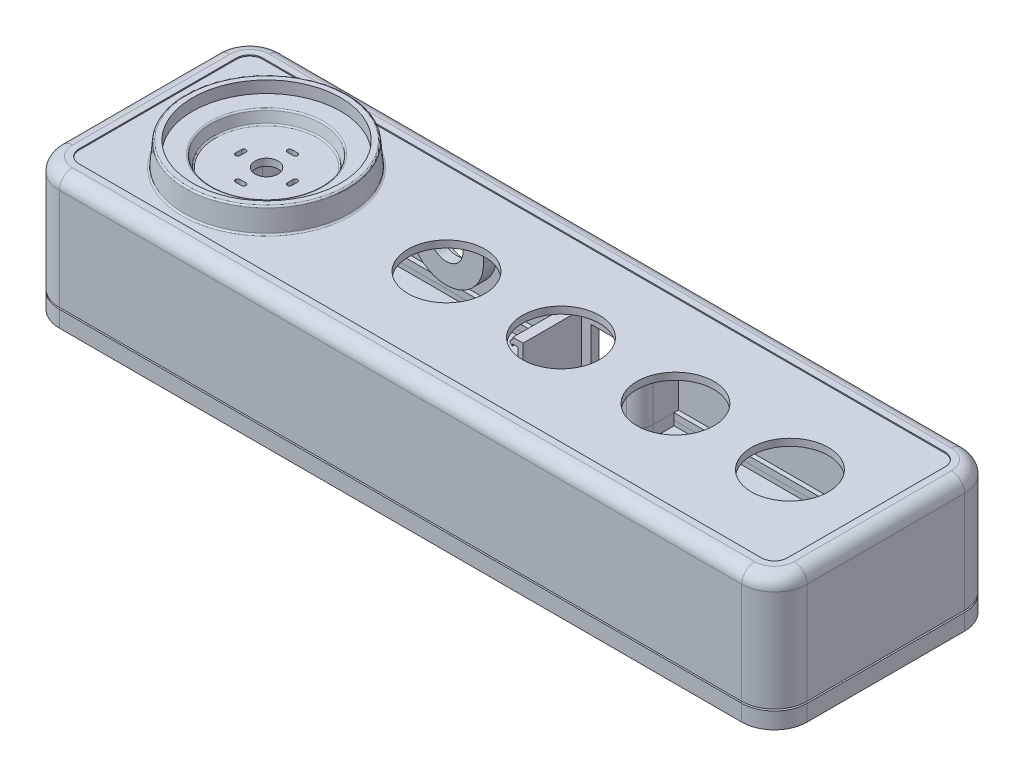
from build123d import *

# Parameters (mm, degrees)
BOSS_EXTRUDE1_DEPTH                            = 35
FILLET1_R                                      = 4
CUT_EXTRUDE6_DEPTH                             = 0.35
SHELL1_T                                       = -2.15
CUT_EXTRUDE1_DEPTH                             = 196.515492994
CUT_EXTRUDE1_DEPTH_BACK                        = 196.515492994
SKETCH1_R                                      = 11.775
SKETCH1_R_2                                    = 3.5
CUT_EXTRUDE4_DEPTH                             = 196.515492994
FILLET3_R                                      = 0.5
CIRPATTERN1_COUNT                              = 4
SKETCH11_R                                     = 2
SKETCH11_R_2                                   = 1.425
BOSS_EXTRUDE3_DEPTH                            = 2
SKETCH11_3_R                                   = 1.425
BOSS_EXTRUDE4_DEPTH                            = 4
BOSS_EXTRUDE5_DEPTH                            = 1.5
CUT_EXTRUDE8_DEPTH                             = 1.5
BOSS_EXTRUDE6_DEPTH                            = 2
BOSS_EXTRUDE7_DEPTH                            = 5
SHELL2_T                                       = -3.5
BOSS_EXTRUDE8_START                            = -15
SKETCH18_R                                     = 2.8
BOSS_EXTRUDE8_DEPTH                            = 15
SKETCH18_3_R                                   = 2.8
CUT_EXTRUDE9_DEPTH                             = 9.5
MIRROR2_START                                  = -15
MIRROR2_COPY_1_SKETCH_R                        = 2.8
MIRROR2_COPY_1_DEPTH                           = 15
MIRROR2_COPY_2_SKETCH_R                        = 2.8
MIRROR2_COPY_2_DEPTH                           = 9.5
CUT_EXTRUDE12_DEPTH                            = 2.28
CUT_EXTRUDE12_DEPTH_BACK                       = 2.28
SKETCH25_W                                     = 14.97
SKETCH25_H                                     = 4.6
CUT_EXTRUDE13_DEPTH                            = 2.82
SKETCH26_W                                     = 8.87
SKETCH26_H                                     = 5.15
BOSS_EXTRUDE13_DEPTH                           = 1.9
SKETCH27_W                                     = 8.87
SKETCH27_H                                     = 1.65
BOSS_EXTRUDE14_DEPTH                           = 0.68
SKETCH29_R                                     = 3.5
SKETCH29_R_2                                   = 5.14
CUT_EXTRUDE14_DEPTH                            = 2.15
SKETCH30_R                                     = 3.5
SKETCH30_R_2                                   = 5.14
BOSS_EXTRUDE15_DEPTH                           = 4
SKETCH31_R                                     = 1.65
CUT_EXTRUDE15_DEPTH                            = 3
SKETCH32_R                                     = 8
SKETCH32_R_2                                   = 6.075
CUT_EXTRUDE16_DEPTH                            = 3
BOSS_EXTRUDE16_DEPTH                           = 31
SKETCH34_W                                     = 9.07
SKETCH34_H                                     = 2.51
BOSS_EXTRUDE17_DEPTH                           = 18.46
BOSS_EXTRUDE18_START                           = 2
BOSS_EXTRUDE18_DEPTH                           = 2
SKETCH36_W                                     = 1.7
SKETCH36_H                                     = 11.2
CUT_EXTRUDE17_DEPTH                            = 0.45
SKETCH37_W                                     = 5.1
SKETCH37_H                                     = 6.27
CUT_EXTRUDE18_DEPTH                            = 0.2
CUT_EXTRUDE19_START                            = -2.15
SKETCH38_R                                     = 2.64
CUT_EXTRUDE19_DEPTH                            = 2.15
SKETCH39_W                                     = 21.06
SKETCH39_H                                     = 15
BOSS_EXTRUDE19_DEPTH                           = 1.5
SKETCH40_R                                     = 1.13
BOSS_EXTRUDE20_DEPTH                           = 2
SKETCH41_W                                     = 21.06
SKETCH41_H                                     = 1.8
SKETCH41_W_2                                   = 20.33
BOSS_EXTRUDE21_DEPTH                           = 1.6
BOSS_EXTRUDE22_DEPTH                           = 1.6
BOSS_EXTRUDE23_DEPTH                           = 15
SKETCH46_R                                     = 2.8
CUT_EXTRUDE21_DEPTH                            = 9.5
BOSS_EXTRUDE25_START                           = 3.5
BOSS_EXTRUDE25_DEPTH                           = 3.5
CSK_FOR_M4_FLAT_HEAD_MACHINE_SCREW1_AT_2_COUNT = 2
CSK_FOR_M4_FLAT_HEAD_MACHINE_SCREW1_AT_2_PITCH = 49.95965928
CSK_FOR_M4_FLAT_HEAD_MACHINE_SCREW1_AT_3_COUNT = 2
CSK_FOR_M4_FLAT_HEAD_MACHINE_SCREW1_AT_3_PITCH = 91.23
CSK_FOR_M4_FLAT_HEAD_MACHINE_SCREW1_AT_4_COUNT = 2
CSK_FOR_M4_FLAT_HEAD_MACHINE_SCREW1_AT_4_PITCH = 116.475847532
CSK_FOR_M4_FLAT_HEAD_MACHINE_SCREW1_AT_5_COUNT = 2
CSK_FOR_M4_FLAT_HEAD_MACHINE_SCREW1_AT_5_PITCH = 216.279338947
CSK_FOR_M4_FLAT_HEAD_MACHINE_SCREW1_AT_6_COUNT = 2
CSK_FOR_M4_FLAT_HEAD_MACHINE_SCREW1_AT_6_PITCH = 210.43


with BuildPart() as part:
    # Sketch2 → Boss-Extrude1 (new body)
    with BuildSketch(Plane(origin=(0, 0, 0), x_dir=(1, 0, 0), z_dir=(0, 1, 0))):
        with BuildLine():
            Line((-29.267817454, 34.05982964), (179.317817454, 34.05982964))
            ThreePointArc((179.317817454, 34.05982964), (186.388885266, 31.130897452), (189.317817454, 24.05982964))
            Line((189.317817454, 24.05982964), (189.317817454, -24.05982964))
            ThreePointArc((189.317817454, -24.05982964), (186.388885266, -31.130897452), (179.317817454, -34.05982964))
            Line((179.317817454, -34.05982964), (-29.267817454, -34.05982964))
            ThreePointArc((-29.267817454, -34.05982964), (-36.338885266, -31.130897452), (-39.267817454, -24.05982964))
            Line((-39.267817454, -24.05982964), (-39.267817454, 24.05982964))
            ThreePointArc((-39.267817454, 24.05982964), (-36.338885266, 31.130897452), (-29.267817454, 34.05982964))
        make_face()
    extrude(amount=-BOSS_EXTRUDE1_DEPTH)

    # Fillet1
    fillet1_edges = [part.edges().sort_by_distance(p)[0] for p in [
        (-39.267817454, 0, 0),
        (-36.338885266, 0, -31.130897452),
        (75.025, 0, -34.05982964),
        (186.388885266, 0, -31.130897452),
        (189.317817454, 0, 0),
        (186.388885266, 0, 31.130897452),
        (75.025, 0, 34.05982964),
        (-36.338885266, 0, 31.130897452),
    ]]
    fillet(fillet1_edges, radius=FILLET1_R)

    # Sketch9 → Cut-Extrude6 (cut)
    with BuildSketch(Plane(origin=(0, 0, 0), x_dir=(1, 0, 0), z_dir=(0, 1, 0))):
        with BuildLine():
            Line((-33.267817454, 24.05982964), (-33.267817454, -24.05982964))
            ThreePointArc((-33.267817454, -24.05982964), (-32.096244578, -26.888256765), (-29.267817454, -28.05982964))
            Line((-29.267817454, -28.05982964), (179.317817454, -28.05982964))
            ThreePointArc((179.317817454, -28.05982964), (182.146244578, -26.888256765), (183.317817454, -24.05982964))
            Line((183.317817454, -24.05982964), (183.317817454, 24.05982964))
            ThreePointArc((183.317817454, 24.05982964), (182.146244578, 26.888256765), (179.317817454, 28.05982964))
            Line((179.317817454, 28.05982964), (-29.267817454, 28.05982964))
            ThreePointArc((-29.267817454, 28.05982964), (-32.096244578, 26.888256765), (-33.267817454, 24.05982964))
        make_face()
    extrude(amount=-CUT_EXTRUDE6_DEPTH, mode=Mode.SUBTRACT)

    # Shell1
    shell1_openings = [part.faces().sort_by_distance(p)[0] for p in [
        (75.025, -35, 0),
    ]]
    offset(amount=SHELL1_T, openings=shell1_openings, kind=Kind.INTERSECTION)

    # Sketch1 → Cut-Extrude1 (cut, two sides: drawn at the far end of the back side and taken through both)
    with BuildSketch(Plane(origin=(0, 0, 0), x_dir=(1, 0, 0), z_dir=(0, 1, 0)).offset(-CUT_EXTRUDE1_DEPTH_BACK)):
        with Locations(Location((55, 0, 0), (0, 0, 270))):
            Circle(SKETCH1_R)
        with Locations(Location((90, 0, 0), (0, 0, 270))):
            Circle(SKETCH1_R)
        with Locations(Location((160, 0, 0), (0, 0, 270))):
            Circle(SKETCH1_R)
        with Locations(Location((125, 0, 0), (0, 0, 270))):
            Circle(SKETCH1_R)
        with Locations(Location((0, 0, 0), (0, 0, 270))):
            Circle(SKETCH1_R_2)
    extrude(amount=CUT_EXTRUDE1_DEPTH + CUT_EXTRUDE1_DEPTH_BACK, mode=Mode.SUBTRACT)

    # Sketch6 → Cut-Extrude4 (cut, symmetric)
    with BuildSketch(Plane(origin=(0, 0, 0), x_dir=(1, 0, 0), z_dir=(0, 1, 0))):
        with BuildLine():
            Line((8.612490822, 0.9), (8.612490822, -0.9))
            ThreePointArc((8.612490822, -0.9), (7.912490822, -1.6), (7.212490822, -0.9))
            Line((7.212490822, -0.9), (7.212490822, 0.9))
            ThreePointArc((7.212490822, 0.9), (7.912490822, 1.6), (8.612490822, 0.9))
        make_face()
    cut_extrude4 = extrude(amount=CUT_EXTRUDE4_DEPTH, both=True, mode=Mode.SUBTRACT)

    # Sketch7 → Revolve1 (revolve)
    with BuildSketch(Plane.XY, mode=Mode.PRIVATE) as revolve1_sk:
        Polygon((-25.278168604, -0.35), (-24.65, 6.83), (-22.65, 6.83), (-22.65, 3.23), (-16.959258109, 3.23), (-16, -0.35), align=None)
    revolve(revolve1_sk.sketch.rotate(Axis((0, 0, 0), (0, 1, 0)), 270), axis=Axis((0, 0, 0), (0, 1, 0)))

    # Fillet3
    fillet3_edges = [part.edges().sort_by_distance(p)[0] for p in [
        (0, -0.35, 25.278168604),
        (0, -0.35, 16),
        (0, 3.23, 16.959258109),
        (0, 6.83, 24.65),
    ]]
    fillet(fillet3_edges, radius=FILLET3_R)

    # CirPattern1: Cut-Extrude4 ×4 about axis
    cirpattern1_axis = Axis((0, 0, 0), (0, 1, 0))
    for i in range(1, CIRPATTERN1_COUNT):
        add(cut_extrude4.rotate(cirpattern1_axis, i * 360 / CIRPATTERN1_COUNT), mode=Mode.SUBTRACT)

    # Sketch11 → Boss-Extrude3 (add)
    # profile 1 of 8: a face of its own
    with BuildSketch(Plane(origin=(0, -2.5, 0), x_dir=(-1, 0, 0), z_dir=(0, -1, 0))):
        with Locations(Location((-33.582182546, 1, 0), (0, 0, 270))):
            Circle(SKETCH11_R)
    # profile 2 of 8: a face of its own
    with BuildSketch(Plane(origin=(0, -2.5, 0), x_dir=(-1, 0, 0), z_dir=(0, -1, 0))):
        with Locations(Location((-20.582182546, 1, 0), (0, 0, 270))):
            Circle(SKETCH11_R)
    # profile 3 of 8: a face of its own
    with BuildSketch(Plane(origin=(0, -2.5, 0), x_dir=(-1, 0, 0), z_dir=(0, -1, 0))):
        with Locations(Location((-28.082182546, -8.5, 0), (0, 0, 270))):
            Circle(SKETCH11_R)
        with Locations((-28.082182546, -8.5)):
            Circle(SKETCH11_R_2, mode=Mode.SUBTRACT)
    # profile 4 of 8: a face of its own
    with BuildSketch(Plane(origin=(0, -2.5, 0), x_dir=(-1, 0, 0), z_dir=(0, -1, 0))):
        with Locations((-28.082182546, -8.5)):
            Circle(SKETCH11_R_2)
    # profile 5 of 8: a face of its own
    with BuildSketch(Plane(origin=(0, -2.5, 0), x_dir=(-1, 0, 0), z_dir=(0, -1, 0))):
        with Locations(Location((-20.582182546, -19, 0), (0, 0, 270))):
            Circle(SKETCH11_R)
        with Locations((-20.582182546, -19)):
            Circle(SKETCH11_R_2, mode=Mode.SUBTRACT)
    # profile 6 of 8: a face of its own
    with BuildSketch(Plane(origin=(0, -2.5, 0), x_dir=(-1, 0, 0), z_dir=(0, -1, 0))):
        with Locations((-20.582182546, -19)):
            Circle(SKETCH11_R_2)
    # profile 7 of 8: a face of its own
    with BuildSketch(Plane(origin=(0, -2.5, 0), x_dir=(-1, 0, 0), z_dir=(0, -1, 0))):
        with Locations(Location((-33.582182546, -19, 0), (0, 0, 270))):
            Circle(SKETCH11_R)
        with Locations((-33.582182546, -19)):
            Circle(SKETCH11_R_2, mode=Mode.SUBTRACT)
    # profile 8 of 8: a face of its own
    with BuildSketch(Plane(origin=(0, -2.5, 0), x_dir=(-1, 0, 0), z_dir=(0, -1, 0))):
        with Locations((-33.582182546, -19)):
            Circle(SKETCH11_R_2)
    extrude(amount=BOSS_EXTRUDE3_DEPTH)

    # Sketch11<3> → Boss-Extrude4 (add)
    with BuildSketch(Plane(origin=(0, -2.5, 0), x_dir=(-1, 0, 0), z_dir=(0, -1, 0))):
        with Locations(Location((-28.082182546, -8.5, 0), (0, 0, 90))):
            Circle(SKETCH11_3_R)
        with Locations(Location((-20.582182546, -19, 0), (0, 0, 90))):
            Circle(SKETCH11_3_R)
        with Locations(Location((-33.582182546, -19, 0), (0, 0, 90))):
            Circle(SKETCH11_3_R)
    extrude(amount=BOSS_EXTRUDE4_DEPTH)

    # Sketch13 → Boss-Extrude5 (add, symmetric)
    with BuildSketch(Plane(origin=(25, 0, 0), x_dir=(0, 0, -1), z_dir=(1, 0, 0))):
        Polygon((-25.25, -2.5), (-25.25, -6.2), (-24, -6.2), (-25.3, -7.5), (-26.8, -7.5), (-27.75, -2.5), align=None)
        Polygon((8.25, -2.5), (8.25, -6.2), (7, -6.2), (8.3, -7.5), (9.8, -7.5), (10.75, -2.5), align=None)
    extrude(amount=BOSS_EXTRUDE5_DEPTH, both=True)

    # Sketch15 → Cut-Extrude8 (cut)
    with BuildSketch(Plane.XZ.offset(35)):
        with BuildLine():
            Line((-29.267817454, -32.75982964), (179.317817454, -32.75982964))
            ThreePointArc((179.317817454, -32.75982964), (185.46964645, -30.211658637), (188.017817454, -24.05982964))
            Line((188.017817454, -24.05982964), (188.017817454, 24.05982964))
            ThreePointArc((188.017817454, 24.05982964), (185.46964645, 30.211658637), (179.317817454, 32.75982964))
            Line((179.317817454, 32.75982964), (-29.267817454, 32.75982964))
            ThreePointArc((-29.267817454, 32.75982964), (-35.41964645, 30.211658637), (-37.967817454, 24.05982964))
            Line((-37.967817454, 24.05982964), (-37.967817454, -24.05982964))
            ThreePointArc((-37.967817454, -24.05982964), (-35.41964645, -30.211658637), (-29.267817454, -32.75982964))
        make_face()
    extrude(amount=-CUT_EXTRUDE8_DEPTH, mode=Mode.SUBTRACT)

    # Sketch18 → Boss-Extrude8 (add)
    # profile 1 of 2: a face of its own
    with BuildSketch(Plane.XZ.offset(33.5).offset(BOSS_EXTRUDE8_START)):
        with BuildLine():
            Line((-37.117817454, 24.05982964), (-37.117817454, 20.05982964))
            Line((-37.117817454, 20.05982964), (-29.267817454, 20.05982964))
            ThreePointArc((-29.267817454, 20.05982964), (-26.439390329, 21.231402515), (-25.267817454, 24.05982964))
            Line((-25.267817454, 24.05982964), (-25.267817454, 31.90982964))
            Line((-25.267817454, 31.90982964), (-29.267817454, 31.90982964))
            ThreePointArc((-29.267817454, 31.90982964), (-34.818605686, 29.610617872), (-37.117817454, 24.05982964))
        make_face()
        with Locations((-30.187817454, 24.97982964)):
            Circle(SKETCH18_R, mode=Mode.SUBTRACT)
    # profile 2 of 2: a face of its own
    with BuildSketch(Plane.XZ.offset(33.5).offset(BOSS_EXTRUDE8_START)):
        with Locations((-30.187817454, 24.97982964)):
            Circle(SKETCH18_R)
    boss_extrude8 = extrude(amount=BOSS_EXTRUDE8_DEPTH)

    # Sketch18<3> → Cut-Extrude9 (cut)
    with BuildSketch(Plane.XZ.offset(33.5)):
        with Locations(Location((-30.187817454, 24.97982964, 0), (0, 0, 270))):
            Circle(SKETCH18_3_R)
    cut_extrude9 = extrude(amount=-CUT_EXTRUDE9_DEPTH, mode=Mode.SUBTRACT)

    # Mirror1: Boss-Extrude8 across plane
    add(boss_extrude8.mirror(Plane.XY))

    # Mirror1 2: Cut-Extrude9 across plane
    add(cut_extrude9.mirror(Plane.XY), mode=Mode.SUBTRACT)

    # Mirror2: Boss-Extrude8, Cut-Extrude9 across plane
    add(boss_extrude8.mirror(Plane.ZY.offset(-75.027182546)))
    add(cut_extrude9.mirror(Plane.ZY.offset(-75.027182546)), mode=Mode.SUBTRACT)

    # Mirror2 copy 1 sketch → Mirror2 copy 1 (add)
    # profile 1 of 2: a face of its own
    with BuildSketch(Plane(origin=(150.054365093, -33.5, 0), x_dir=(-1, 0, 0), z_dir=(0, -1, 0)).offset(MIRROR2_START)):
        with BuildLine():
            Line((-37.117817454, 24.05982964), (-37.117817454, 20.05982964))
            Line((-37.117817454, 20.05982964), (-29.267817454, 20.05982964))
            ThreePointArc((-29.267817454, 20.05982964), (-26.439390329, 21.231402515), (-25.267817454, 24.05982964))
            Line((-25.267817454, 24.05982964), (-25.267817454, 31.90982964))
            Line((-25.267817454, 31.90982964), (-29.267817454, 31.90982964))
            ThreePointArc((-29.267817454, 31.90982964), (-34.818605686, 29.610617872), (-37.117817454, 24.05982964))
        make_face()
        with Locations((-30.187817454, 24.97982964)):
            Circle(MIRROR2_COPY_1_SKETCH_R, mode=Mode.SUBTRACT)
    # profile 2 of 2: a face of its own
    with BuildSketch(Plane(origin=(150.054365093, -33.5, 0), x_dir=(-1, 0, 0), z_dir=(0, -1, 0)).offset(MIRROR2_START)):
        with Locations((-30.187817454, 24.97982964)):
            Circle(MIRROR2_COPY_1_SKETCH_R)
    extrude(amount=MIRROR2_COPY_1_DEPTH)

    # Mirror2 copy 2 sketch → Mirror2 copy 2 (cut)
    with BuildSketch(Plane(origin=(150.054365093, -33.5, 0), x_dir=(-1, 0, 0), z_dir=(0, -1, 0))):
        with Locations(Location((-30.187817454, 24.97982964, 0), (0, 0, 270))):
            Circle(MIRROR2_COPY_2_SKETCH_R)
    extrude(amount=-MIRROR2_COPY_2_DEPTH, mode=Mode.SUBTRACT)

    # Sketch22 → Cut-Extrude12 (cut, two sides: drawn at the far end of the back side and taken through both)
    with BuildSketch(Plane.XY.offset(-32.75982964).offset(-CUT_EXTRUDE12_DEPTH_BACK)):
        with BuildLine():
            Line((67.542182546, -35), (67.542182546, -26.488433197))
            ThreePointArc((67.542182546, -26.488433197), (75.027182546, -19.003433197), (82.512182546, -26.488433197))
            Line((82.512182546, -26.488433197), (82.512182546, -35))
            Line((82.512182546, -35), (67.542182546, -35))
        make_face()
    extrude(amount=CUT_EXTRUDE12_DEPTH + CUT_EXTRUDE12_DEPTH_BACK, mode=Mode.SUBTRACT)

    # Sketch29 → Cut-Extrude14 (cut)
    with BuildSketch(Plane(origin=(0, 0, -34.05982964), x_dir=(-1, 0, 0), z_dir=(0, 0, -1))):
        with Locations((7.117817454, -20.536803536)):
            Circle(SKETCH29_R)
        with Locations((-27.01592381, -20.536803536)):
            Circle(SKETCH29_R_2)
    extrude(amount=-CUT_EXTRUDE14_DEPTH, mode=Mode.SUBTRACT)

    # Sketch30 → Boss-Extrude15 (add)
    with BuildSketch(Plane.XY.offset(-31.90982964)):
        with BuildLine():
            Line((-0.617817454, -20.536803536), (15.62592381, -20.536803536))
            ThreePointArc((15.62592381, -20.536803536), (27.01592381, -31.926803536), (38.40592381, -20.536803536))
            Line((38.40592381, -20.536803536), (38.40592381, -4))
            Line((38.40592381, -4), (-13.617817454, -4))
            Line((-13.617817454, -4), (-13.617817454, -20.536803536))
            ThreePointArc((-13.617817454, -20.536803536), (-7.117817454, -27.036803536), (-0.617817454, -20.536803536))
        make_face()
        with Locations(Location((-7.117817454, -20.536803536, 0), (0, 0, 180))):
            Circle(SKETCH30_R, mode=Mode.SUBTRACT)
        with Locations(Location((27.01592381, -20.536803536, 0), (0, 0, 180))):
            Circle(SKETCH30_R_2, mode=Mode.SUBTRACT)
    extrude(amount=BOSS_EXTRUDE15_DEPTH)

    # Sketch31 → Cut-Extrude15 (cut)
    with BuildSketch(Plane.XY.offset(-27.90982964)):
        with Locations((27.01592381, -11.036803536)):
            Circle(SKETCH31_R)
        with BuildLine():
            Line((-8.042817454, -12.032674317), (-6.192817454, -12.032674317))
            ThreePointArc((-6.192817454, -12.032674317), (-5.507817454, -12.717674317), (-6.192817454, -13.402674317))
            Line((-6.192817454, -13.402674317), (-8.042817454, -13.402674317))
            ThreePointArc((-8.042817454, -13.402674317), (-8.727817454, -12.717674317), (-8.042817454, -12.032674317))
        make_face()
    extrude(amount=-CUT_EXTRUDE15_DEPTH, mode=Mode.SUBTRACT)

    # Sketch32 → Cut-Extrude16 (cut)
    with BuildSketch(Plane(origin=(0, 0, -34.05982964), x_dir=(-1, 0, 0), z_dir=(0, 0, -1))):
        with Locations((-27.01592381, -20.536803536)):
            Circle(SKETCH32_R)
        with Locations((7.117817454, -20.536803536)):
            Circle(SKETCH32_R_2)
    extrude(amount=-CUT_EXTRUDE16_DEPTH, mode=Mode.SUBTRACT)

    # Sketch33 → Boss-Extrude16 (add)
    with BuildSketch(Plane.XZ.offset(2.5)):
        Polygon((67.542182546, -31.90982964), (67.542182546, -31.17982964), (70.492182546, -31.17982964), (70.492182546, -28.66982964), (66.042182546, -28.66982964), (66.042182546, -31.90982964), align=None)
        Polygon((82.512182546, -31.90982964), (82.512182546, -31.17982964), (79.562182546, -31.17982964), (79.562182546, -28.66982964), (84.012182546, -28.66982964), (84.012182546, -31.90982964), align=None)
    extrude(amount=BOSS_EXTRUDE16_DEPTH)

    # Sketch34 → Boss-Extrude17 (add)
    with BuildSketch(Plane.XZ.offset(2.5)):
        with Locations((75.027182546, -29.92482964)):
            Rectangle(SKETCH34_W, SKETCH34_H)
    extrude(amount=BOSS_EXTRUDE17_DEPTH)

    # Sketch35 → Boss-Extrude18 (add)
    with BuildSketch(Plane(origin=(0, 0, -31.17982964), x_dir=(-1, 0, 0), z_dir=(0, 0, -1)).offset(BOSS_EXTRUDE18_START)):
        with BuildLine():
            Line((-82.512182546, -26.488433197), (-82.512182546, -2.527553057))
            Line((-82.512182546, -2.527553057), (-67.542182546, -2.527553057))
            Line((-67.542182546, -2.527553057), (-67.542182546, -26.488433197))
            ThreePointArc((-67.542182546, -26.488433197), (-75.027182546, -19.003433197), (-82.512182546, -26.488433197))
        make_face()
    extrude(amount=-BOSS_EXTRUDE18_DEPTH)

    # Sketch36 → Cut-Extrude17 (cut)
    with BuildSketch(Plane.XY.offset(-31.90982964)):
        with Locations((65.192182546, -26)):
            Rectangle(SKETCH36_W, SKETCH36_H)
    extrude(amount=-CUT_EXTRUDE17_DEPTH, mode=Mode.SUBTRACT)

    # Sketch37 → Cut-Extrude18 (cut)
    with BuildSketch(Plane.XY.offset(-31.90982964)):
        with Locations((61.892182546, -23.88)):
            Rectangle(SKETCH37_W, SKETCH37_H)
    extrude(amount=-CUT_EXTRUDE18_DEPTH, mode=Mode.SUBTRACT)

    # Sketch38 → Cut-Extrude19 (cut)
    with BuildSketch(Plane(origin=(0, 0, -34.05982964), x_dir=(-1, 0, 0), z_dir=(0, 0, -1)).offset(CUT_EXTRUDE19_START)):
        with Locations((-61.942182546, -23.88)):
            Circle(SKETCH38_R)
    extrude(amount=CUT_EXTRUDE19_DEPTH, mode=Mode.SUBTRACT)

    # Sketch39 → Boss-Extrude19 (add)
    with BuildSketch(Plane(origin=(66.042182546, 0, 0), x_dir=(0, 0, -1), z_dir=(1, 0, 0))):
        with Locations((21.37982964, -26)):
            Rectangle(SKETCH39_W, SKETCH39_H)
    extrude(amount=BOSS_EXTRUDE19_DEPTH)

    # Sketch40 → Boss-Extrude20 (add)
    with BuildSketch(Plane.ZY.offset(-66.042182546)):
        with Locations(Location((-13.84982964, -26.75, 0), (0, 0, 180))):
            Circle(SKETCH40_R)
    extrude(amount=BOSS_EXTRUDE20_DEPTH)

    # Sketch41 → Boss-Extrude21 (add)
    with BuildSketch(Plane.ZY.offset(-66.042182546)):
        with Locations((-21.37982964, -19.4)):
            Rectangle(SKETCH41_W, SKETCH41_H)
        with Locations((-21.01482964, -32.6)):
            Rectangle(SKETCH41_W_2, SKETCH41_H)
    extrude(amount=BOSS_EXTRUDE21_DEPTH)

    # Sketch42 → Boss-Extrude22 (add)
    with BuildSketch(Plane.XY.offset(-10.84982964)):
        Polygon((64.442182546, -31.7), (64.342182546, -31.7), (64.342182546, -31.15), (64.142182546, -31.15), (63.592182546, -31.75), (63.592182546, -32.25), (64.442182546, -33), align=None)
        Polygon((64.442182546, -19), (64.442182546, -20.3), (64.342182546, -20.3), (64.342182546, -20.85), (64.142182546, -20.85), (63.592182546, -20.25), (63.592182546, -19.75), align=None)
    extrude(amount=-BOSS_EXTRUDE22_DEPTH)

    # Sketch45 → Boss-Extrude23 (add)
    with BuildSketch(Plane.XZ.offset(33.5)):
        with BuildLine():
            Line((84.012182546, -31.90982964), (94.012182546, -31.90982964))
            Line((94.012182546, -31.90982964), (94.012182546, -24.05982964))
            ThreePointArc((94.012182546, -24.05982964), (92.840609671, -21.231402515), (90.012182546, -20.05982964))
            Line((90.012182546, -20.05982964), (88.012182546, -20.05982964))
            ThreePointArc((88.012182546, -20.05982964), (85.183755422, -21.231402515), (84.012182546, -24.05982964))
            Line((84.012182546, -24.05982964), (84.012182546, -31.90982964))
        make_face()
        with BuildLine():
            Line((70.025, 32.75982964), (80.025, 32.75982964))
            Line((80.025, 32.75982964), (80.025, 24.05982964))
            ThreePointArc((80.025, 24.05982964), (78.853427125, 21.231402515), (76.025, 20.05982964))
            Line((76.025, 20.05982964), (74.025, 20.05982964))
            ThreePointArc((74.025, 20.05982964), (71.196572875, 21.231402515), (70.025, 24.05982964))
            Line((70.025, 24.05982964), (70.025, 32.75982964))
        make_face()
    extrude(amount=-BOSS_EXTRUDE23_DEPTH)

    # Sketch46 → Cut-Extrude21 (cut)
    with BuildSketch(Plane.XZ.offset(33.5)):
        with Locations(Location((75.025, 24.97982964, 0), (0, 0, 270))):
            Circle(SKETCH46_R)
        with Locations(Location((89.012182546, -24.97982964, 0), (0, 0, 270))):
            Circle(SKETCH46_R)
    extrude(amount=-CUT_EXTRUDE21_DEPTH, mode=Mode.SUBTRACT)


with BuildPart() as body_2:
    # Sketch16 → Boss-Extrude6 (new body)
    with BuildSketch(Plane.XZ.offset(33.5)):
        with BuildLine():
            Line((-29.267817454, -32.50982964), (179.317817454, -32.50982964))
            ThreePointArc((179.317817454, -32.50982964), (185.292869755, -30.034881941), (187.767817454, -24.05982964))
            Line((187.767817454, -24.05982964), (187.767817454, 24.05982964))
            ThreePointArc((187.767817454, 24.05982964), (185.292869755, 30.034881941), (179.317817454, 32.50982964))
            Line((179.317817454, 32.50982964), (-29.267817454, 32.50982964))
            ThreePointArc((-29.267817454, 32.50982964), (-35.242869755, 30.034881941), (-37.717817454, 24.05982964))
            Line((-37.717817454, 24.05982964), (-37.717817454, -24.05982964))
            ThreePointArc((-37.717817454, -24.05982964), (-35.242869755, -30.034881941), (-29.267817454, -32.50982964))
        make_face()
        with BuildLine():
            Line((-29.267817454, -30.50982964), (179.317817454, -30.50982964))
            ThreePointArc((179.317817454, -30.50982964), (183.878656192, -28.620668379), (185.767817454, -24.05982964))
            Line((185.767817454, -24.05982964), (185.767817454, 24.05982964))
            ThreePointArc((185.767817454, 24.05982964), (183.878656192, 28.620668379), (179.317817454, 30.50982964))
            Line((179.317817454, 30.50982964), (-29.267817454, 30.50982964))
            ThreePointArc((-29.267817454, 30.50982964), (-33.828656192, 28.620668379), (-35.717817454, 24.05982964))
            Line((-35.717817454, 24.05982964), (-35.717817454, -24.05982964))
            ThreePointArc((-35.717817454, -24.05982964), (-33.828656192, -28.620668379), (-29.267817454, -30.50982964))
        make_face(mode=Mode.SUBTRACT)
    extrude(amount=BOSS_EXTRUDE6_DEPTH)


with BuildPart() as body_3:
    # Sketch17 → Boss-Extrude7 (new body)
    with BuildSketch(Plane.XZ.offset(35.5)):
        with BuildLine():
            Line((179.317817454, -34.05982964), (-29.267817454, -34.05982964))
            ThreePointArc((-29.267817454, -34.05982964), (-36.338885266, -31.130897452), (-39.267817454, -24.05982964))
            Line((-39.267817454, -24.05982964), (-39.267817454, 24.05982964))
            ThreePointArc((-39.267817454, 24.05982964), (-36.338885266, 31.130897452), (-29.267817454, 34.05982964))
            Line((-29.267817454, 34.05982964), (179.317817454, 34.05982964))
            ThreePointArc((179.317817454, 34.05982964), (186.388885266, 31.130897452), (189.317817454, 24.05982964))
            Line((189.317817454, 24.05982964), (189.317817454, -24.05982964))
            ThreePointArc((189.317817454, -24.05982964), (186.388885266, -31.130897452), (179.317817454, -34.05982964))
        make_face()
    extrude(amount=BOSS_EXTRUDE7_DEPTH)

    # Shell2
    shell2_openings = [body_3.faces().sort_by_distance(p)[0] for p in [
        (75.025, -35.5, 0),
    ]]
    offset(amount=SHELL2_T, openings=shell2_openings, kind=Kind.INTERSECTION)

    # Combine1: union body 2
    add(body_2.part)

    # Sketch25 → Cut-Extrude13 (cut)
    with BuildSketch(Plane(origin=(0, 0, -34.05982964), x_dir=(-1, 0, 0), z_dir=(0, 0, -1))):
        with Locations((-75.027182546, -35.8)):
            Rectangle(SKETCH25_W, SKETCH25_H)
    extrude(amount=-CUT_EXTRUDE13_DEPTH, mode=Mode.SUBTRACT)

    # Sketch26 → Boss-Extrude13 (add)
    with BuildSketch(Plane.XY.offset(-30.55982964)):
        with Locations((75.027182546, -34.425)):
            Rectangle(SKETCH26_W, SKETCH26_H)
    extrude(amount=BOSS_EXTRUDE13_DEPTH)

    # Sketch27 → Boss-Extrude14 (add)
    with BuildSketch(Plane(origin=(0, 0, -30.55982964), x_dir=(-1, 0, 0), z_dir=(0, 0, -1))):
        with Locations((-75.027182546, -32.675)):
            Rectangle(SKETCH27_W, SKETCH27_H)
    extrude(amount=BOSS_EXTRUDE14_DEPTH)

    # Sketch47 → Boss-Extrude25 (add)
    with BuildSketch(Plane(origin=(0, -37, 0), x_dir=(1, 0, 0), z_dir=(0, 1, 0)).offset(BOSS_EXTRUDE25_START)):
        with BuildLine():
            Line((84.012182546, 30.20982964), (84.012182546, 28.66982964))
            Line((84.012182546, 28.66982964), (84.012182546, 24.05982964))
            ThreePointArc((84.012182546, 24.05982964), (85.183755422, 21.231402515), (88.012182546, 20.05982964))
            Line((88.012182546, 20.05982964), (90.012182546, 20.05982964))
            ThreePointArc((90.012182546, 20.05982964), (92.840609671, 21.231402515), (94.012182546, 24.05982964))
            Line((94.012182546, 24.05982964), (94.012182546, 30.55982964))
            Line((94.012182546, 30.55982964), (84.012182546, 30.55982964))
            Line((84.012182546, 30.55982964), (84.012182546, 30.20982964))
        make_face()
        with BuildLine():
            Line((80.025, -30.55982964), (80.025, -24.05982964))
            ThreePointArc((80.025, -24.05982964), (78.853427125, -21.231402515), (76.025, -20.05982964))
            Line((76.025, -20.05982964), (74.025, -20.05982964))
            ThreePointArc((74.025, -20.05982964), (71.196572875, -21.231402515), (70.025, -24.05982964))
            Line((70.025, -24.05982964), (70.025, -30.55982964))
            Line((70.025, -30.55982964), (80.025, -30.55982964))
        make_face()
        with BuildLine():
            Line((185.817817454, 20.05982964), (179.322182546, 20.05982964))
            ThreePointArc((179.322182546, 20.05982964), (176.493755422, 21.231402515), (175.322182546, 24.05982964))
            Line((175.322182546, 24.05982964), (175.322182546, 30.55982964))
            Line((175.322182546, 30.55982964), (179.317817454, 30.55982964))
            ThreePointArc((179.317817454, 30.55982964), (183.914011531, 28.656023718), (185.817817454, 24.05982964))
            Line((185.817817454, 24.05982964), (185.817817454, 20.05982964))
        make_face()
        with BuildLine():
            Line((185.817817454, -20.05982964), (179.322182546, -20.05982964))
            ThreePointArc((179.322182546, -20.05982964), (176.493755422, -21.231402515), (175.322182546, -24.05982964))
            Line((175.322182546, -24.05982964), (175.322182546, -30.55982964))
            Line((175.322182546, -30.55982964), (179.317817454, -30.55982964))
            ThreePointArc((179.317817454, -30.55982964), (183.914011531, -28.656023718), (185.817817454, -24.05982964))
            Line((185.817817454, -24.05982964), (185.817817454, -20.05982964))
        make_face()
        with BuildLine():
            Line((-25.267817454, 24.05982964), (-25.267817454, 30.55982964))
            Line((-25.267817454, 30.55982964), (-29.267817454, 30.55982964))
            ThreePointArc((-29.267817454, 30.55982964), (-33.864011531, 28.656023718), (-35.767817454, 24.05982964))
            Line((-35.767817454, 24.05982964), (-35.767817454, 20.05982964))
            Line((-35.767817454, 20.05982964), (-29.267817454, 20.05982964))
            ThreePointArc((-29.267817454, 20.05982964), (-26.439390329, 21.231402515), (-25.267817454, 24.05982964))
        make_face()
        with BuildLine():
            Line((-25.267817454, -24.05982964), (-25.267817454, -30.55982964))
            Line((-25.267817454, -30.55982964), (-29.267817454, -30.55982964))
            ThreePointArc((-29.267817454, -30.55982964), (-33.864011531, -28.656023718), (-35.767817454, -24.05982964))
            Line((-35.767817454, -24.05982964), (-35.767817454, -20.05982964))
            Line((-35.767817454, -20.05982964), (-29.267817454, -20.05982964))
            ThreePointArc((-29.267817454, -20.05982964), (-26.439390329, -21.231402515), (-25.267817454, -24.05982964))
        make_face()
    extrude(amount=-BOSS_EXTRUDE25_DEPTH)

    # Sketch49 → CSK for M4 Flat Head Machine Screw1 (revolve, cut)
    with BuildSketch(Plane(origin=(180.242182546, -40.5, -24.97982964), x_dir=(0, 0, -1), z_dir=(1, 0, 0))):
        Polygon((0, 0), (0, 47.33), (2.25, 47.33), (2.25, 2.45), (4.7, 0), align=None)
    csk_for_m4_flat_head_machine_screw1 = revolve(axis=Axis((180.242182546, -46.85, -24.97982964), (0, 1, 0)), mode=Mode.SUBTRACT)

    # CSK for M4 Flat Head Machine Screw1 at 2: CSK for M4 Flat Head Machine Screw1 ×2
    with Locations(*[(0, 0, i * CSK_FOR_M4_FLAT_HEAD_MACHINE_SCREW1_AT_2_PITCH) for i in range(1, CSK_FOR_M4_FLAT_HEAD_MACHINE_SCREW1_AT_2_COUNT)]):
        add(csk_for_m4_flat_head_machine_screw1, mode=Mode.SUBTRACT)

    # CSK for M4 Flat Head Machine Screw1 at 3: CSK for M4 Flat Head Machine Screw1 ×2
    with Locations(*[(-i * CSK_FOR_M4_FLAT_HEAD_MACHINE_SCREW1_AT_3_PITCH, 0, 0) for i in range(1, CSK_FOR_M4_FLAT_HEAD_MACHINE_SCREW1_AT_3_COUNT)]):
        add(csk_for_m4_flat_head_machine_screw1, mode=Mode.SUBTRACT)

    # CSK for M4 Flat Head Machine Screw1 at 4: CSK for M4 Flat Head Machine Screw1 ×2
    with Locations(*[Vector(-0.9033390593447865, 0, 0.42892720112167776) * (i * CSK_FOR_M4_FLAT_HEAD_MACHINE_SCREW1_AT_4_PITCH) for i in range(1, CSK_FOR_M4_FLAT_HEAD_MACHINE_SCREW1_AT_4_COUNT)]):
        add(csk_for_m4_flat_head_machine_screw1, mode=Mode.SUBTRACT)

    # CSK for M4 Flat Head Machine Screw1 at 5: CSK for M4 Flat Head Machine Screw1 ×2
    with Locations(*[Vector(-0.972954703044634, 0, 0.23099598659571563) * (i * CSK_FOR_M4_FLAT_HEAD_MACHINE_SCREW1_AT_5_PITCH) for i in range(1, CSK_FOR_M4_FLAT_HEAD_MACHINE_SCREW1_AT_5_COUNT)]):
        add(csk_for_m4_flat_head_machine_screw1, mode=Mode.SUBTRACT)

    # CSK for M4 Flat Head Machine Screw1 at 6: CSK for M4 Flat Head Machine Screw1 ×2
    with Locations(*[(-i * CSK_FOR_M4_FLAT_HEAD_MACHINE_SCREW1_AT_6_PITCH, 0, 0) for i in range(1, CSK_FOR_M4_FLAT_HEAD_MACHINE_SCREW1_AT_6_COUNT)]):
        add(csk_for_m4_flat_head_machine_screw1, mode=Mode.SUBTRACT)


solid = Compound([part.part, body_3.part])
